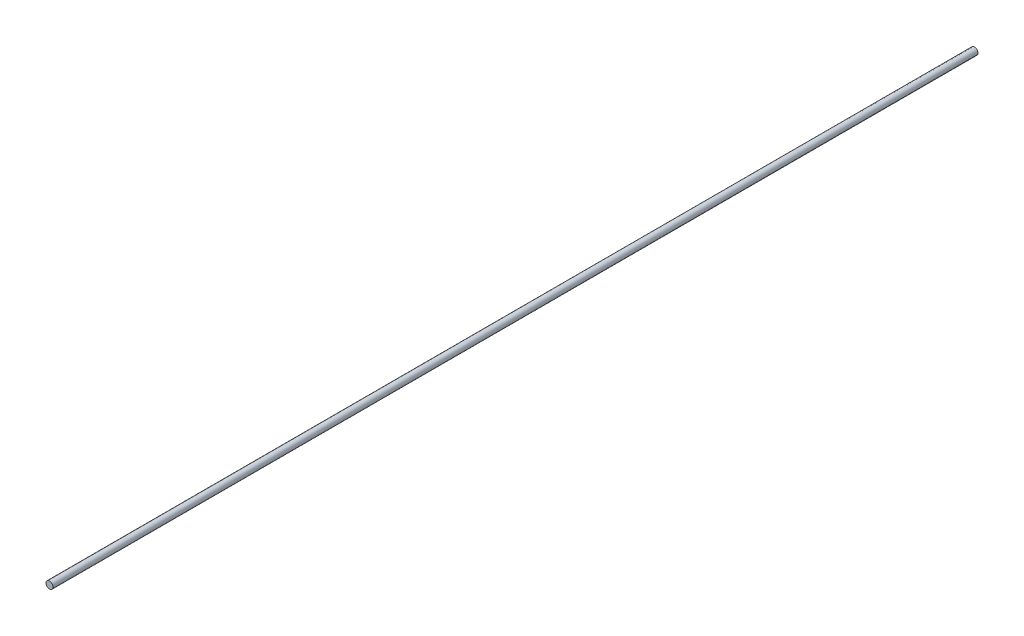
from build123d import *

# Parameters (mm, degrees)
SKETCH1_R = 2.5
ROD_DEPTH = 663


with BuildPart() as part:
    # Sketch1 → Rod (new body)
    with BuildSketch(Plane.XY):
        Circle(SKETCH1_R)
    extrude(amount=ROD_DEPTH)


solid = part.part
